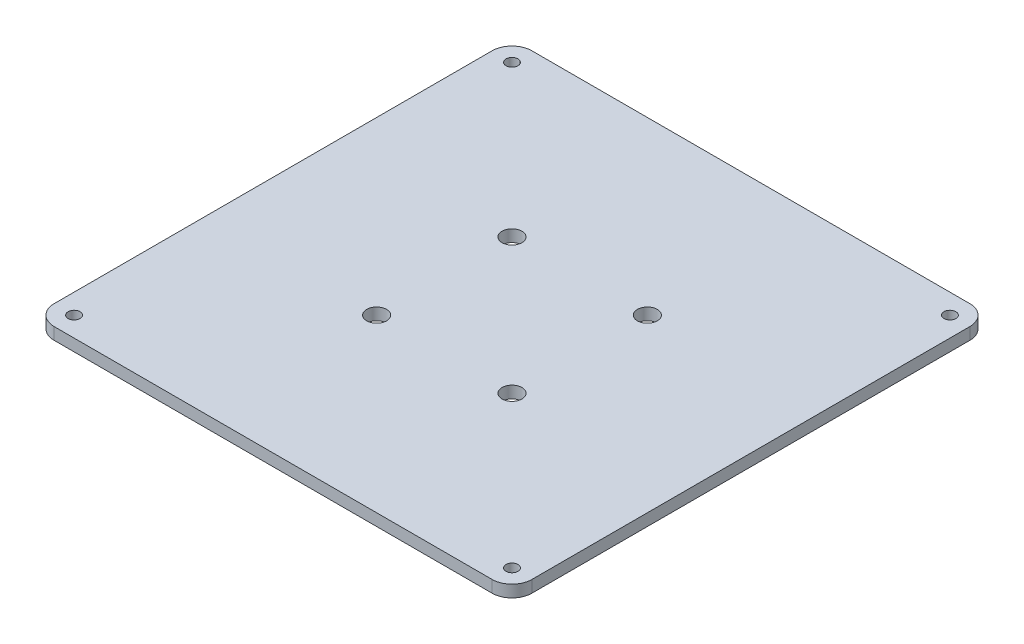
from build123d import *

# Parameters (mm, degrees)
SKETCH1_W                                  = 120
SKETCH1_H                                  = 120
SKETCH1_R                                  = 2.5
BOSS_EXTRUDE1_DEPTH                        = 3
FILLET1_R                                  = 5
SKETCH2_R                                  = 1.5
CUT_EXTRUDE1_DEPTH                         = 85.905830189
MIRROR3_AT_THE_SECOND_PLANE_COPY_1_SKETC_R = 1.5
MIRROR3_AT_THE_SECOND_PLANE_COPY_1_DEPTH   = 85.905830189


with BuildPart() as part:
    # Sketch1 → Boss-Extrude1 (new body)
    with BuildSketch(Plane(origin=(0, 0, 0), x_dir=(1, 0, 0), z_dir=(0, 1, 0))):
        Rectangle(SKETCH1_W, SKETCH1_H)
        with Locations((-17, -17)):
            Circle(SKETCH1_R, mode=Mode.SUBTRACT)
        with Locations((17, 17)):
            Circle(SKETCH1_R, mode=Mode.SUBTRACT)
        with Locations((17, -17)):
            Circle(SKETCH1_R, mode=Mode.SUBTRACT)
        with Locations((-17, 17)):
            Circle(SKETCH1_R, mode=Mode.SUBTRACT)
    extrude(amount=BOSS_EXTRUDE1_DEPTH)

    # Fillet1
    fillet1_edges = [part.edges().sort_by_distance(p)[0] for p in [
        (-60, 1.5, -60),
        (60, 1.5, -60),
        (60, 1.5, 60),
        (-60, 1.5, 60),
    ]]
    fillet(fillet1_edges, radius=FILLET1_R)

    # Sketch2 → Cut-Extrude1 (cut, through all)
    with BuildSketch(Plane(origin=(0, 3, 0), x_dir=(1, 0, 0), z_dir=(0, 1, 0))):
        with Locations((-55, 55)):
            Circle(SKETCH2_R)
    cut_extrude1 = extrude(amount=-CUT_EXTRUDE1_DEPTH, mode=Mode.SUBTRACT)

    # Mirror3: Cut-Extrude1 across plane
    add(cut_extrude1.mirror(Plane.XY), mode=Mode.SUBTRACT)

    # Mirror3 at the second plane: Cut-Extrude1 across plane
    add(cut_extrude1.mirror(Plane(origin=(0, 0, 0), x_dir=(0, 0, 1), z_dir=(1, 0, 0))), mode=Mode.SUBTRACT)

    # Mirror3 at the second plane copy 1 sketc → Mirror3 at the second plane copy 1 (cut, through all)
    with BuildSketch(Plane(origin=(0, 3, 0), x_dir=(-1, 0, 0), z_dir=(0, 1, 0))):
        with Locations((-55, 55)):
            Circle(MIRROR3_AT_THE_SECOND_PLANE_COPY_1_SKETC_R)
    extrude(amount=-MIRROR3_AT_THE_SECOND_PLANE_COPY_1_DEPTH, mode=Mode.SUBTRACT)


solid = part.part
